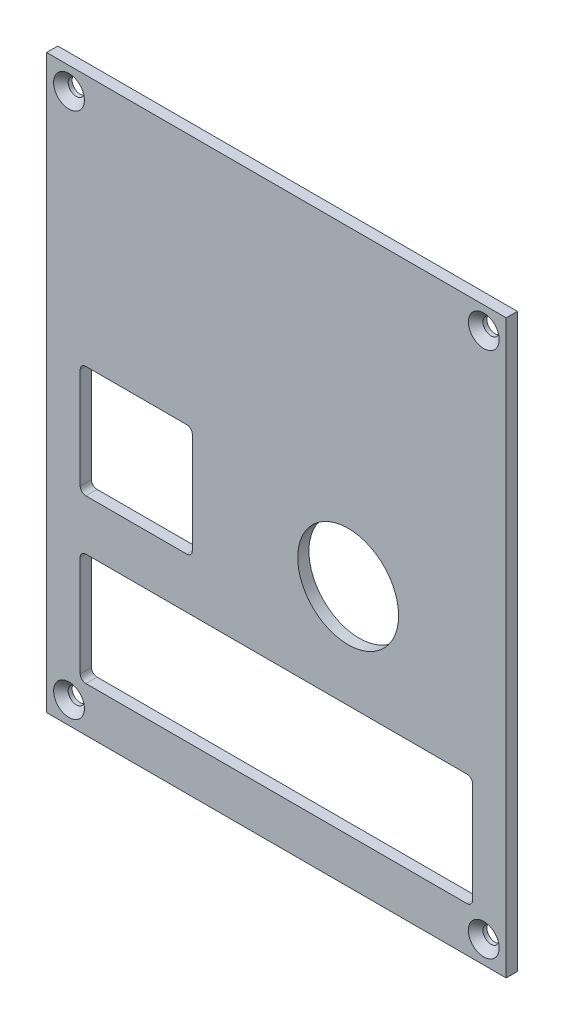
from build123d import *

# Parameters (mm, degrees)
SKETCH1_W                                    = 82
SKETCH1_H                                    = 102
BOSS_EXTRUDE1_DEPTH                          = 2
SKETCH2_R                                    = 9
CUT_EXTRUDE2_DEPTH                           = 2
CSK_FOR_M2_5_COUNTERSUNK_FLAT_HEAD_S_2_COUNT = 2
CSK_FOR_M2_5_COUNTERSUNK_FLAT_HEAD_S_2_PITCH = 94
CSK_FOR_M2_5_COUNTERSUNK_FLAT_HEAD_S_3_COUNT = 2
CSK_FOR_M2_5_COUNTERSUNK_FLAT_HEAD_S_3_PITCH = 119.63277143
CSK_FOR_M2_5_COUNTERSUNK_FLAT_HEAD_S_4_COUNT = 2
CSK_FOR_M2_5_COUNTERSUNK_FLAT_HEAD_S_4_PITCH = 74


with BuildPart() as part:
    # Sketch1 → Boss-Extrude1 (new body)
    with BuildSketch(Plane.XY):
        with Locations((-8.498222994, 4.726902457)):
            Rectangle(SKETCH1_W, SKETCH1_H)
    extrude(amount=BOSS_EXTRUDE1_DEPTH)

    # Sketch2 → Cut-Extrude2 (cut)
    with BuildSketch(Plane.XY.offset(2)):
        with Locations((4.301781638, 0.112195324)):
            Circle(SKETCH2_R)
        with BuildLine():
            Line((-42.498222994, -18.273097543), (25.501777006, -18.273097543))
            ThreePointArc((25.501777006, -18.273097543), (26.208883787, -18.565990762), (26.501777006, -19.273097543))
            Line((26.501777006, -19.273097543), (26.501777006, -37.273097543))
            ThreePointArc((26.501777006, -37.273097543), (26.208883787, -37.980204324), (25.501777006, -38.273097543))
            Line((25.501777006, -38.273097543), (-42.498222994, -38.273097543))
            ThreePointArc((-42.498222994, -38.273097543), (-43.205329775, -37.980204324), (-43.498222994, -37.273097543))
            Line((-43.498222994, -37.273097543), (-43.498222994, -19.273097543))
            ThreePointArc((-43.498222994, -19.273097543), (-43.205329775, -18.565990762), (-42.498222994, -18.273097543))
        make_face()
        with BuildLine():
            Line((-42.498222994, 10.726902457), (-24.498222994, 10.726902457))
            ThreePointArc((-24.498222994, 10.726902457), (-23.791116213, 10.434009238), (-23.498222994, 9.726902457))
            Line((-23.498222994, 9.726902457), (-23.498222994, -8.273097543))
            ThreePointArc((-23.498222994, -8.273097543), (-23.791116213, -8.980204324), (-24.498222994, -9.273097543))
            Line((-24.498222994, -9.273097543), (-42.498222994, -9.273097543))
            ThreePointArc((-42.498222994, -9.273097543), (-43.205329775, -8.980204324), (-43.498222994, -8.273097543))
            Line((-43.498222994, -8.273097543), (-43.498222994, 9.726902457))
            ThreePointArc((-43.498222994, 9.726902457), (-43.205329775, 10.434009238), (-42.498222994, 10.726902457))
        make_face()
    extrude(amount=-CUT_EXTRUDE2_DEPTH, mode=Mode.SUBTRACT)

    # Sketch18 → CSK for M2.5 Countersunk Flat Head Screw2 (revolve, cut)
    with BuildSketch(Plane(origin=(-45.498222994, 51.726902457, 2), x_dir=(0, -1, 0), z_dir=(1, 0, 0))):
        Polygon((0, 0), (0, 2), (1.45, 2), (1.45, 1.3), (2.75, 0), align=None)
    csk_for_m2_5_countersunk_flat_head_screw = revolve(axis=Axis((-45.498222994, 51.726902457, 8.35), (0, 0, -1)), mode=Mode.SUBTRACT)

    # CSK for M2.5 Countersunk Flat Head S 2: CSK for M2.5 Countersunk Flat Head Screw2 ×2
    with Locations(*[(0, -i * CSK_FOR_M2_5_COUNTERSUNK_FLAT_HEAD_S_2_PITCH, 0) for i in range(1, CSK_FOR_M2_5_COUNTERSUNK_FLAT_HEAD_S_2_COUNT)]):
        add(csk_for_m2_5_countersunk_flat_head_screw, mode=Mode.SUBTRACT)

    # CSK for M2.5 Countersunk Flat Head S 3: CSK for M2.5 Countersunk Flat Head Screw2 ×2
    with Locations(*[Vector(0.6185596063312608, -0.7857378783126824, 0) * (i * CSK_FOR_M2_5_COUNTERSUNK_FLAT_HEAD_S_3_PITCH) for i in range(1, CSK_FOR_M2_5_COUNTERSUNK_FLAT_HEAD_S_3_COUNT)]):
        add(csk_for_m2_5_countersunk_flat_head_screw, mode=Mode.SUBTRACT)

    # CSK for M2.5 Countersunk Flat Head S 4: CSK for M2.5 Countersunk Flat Head Screw2 ×2
    with Locations(*[(i * CSK_FOR_M2_5_COUNTERSUNK_FLAT_HEAD_S_4_PITCH, 0, 0) for i in range(1, CSK_FOR_M2_5_COUNTERSUNK_FLAT_HEAD_S_4_COUNT)]):
        add(csk_for_m2_5_countersunk_flat_head_screw, mode=Mode.SUBTRACT)


solid = part.part
